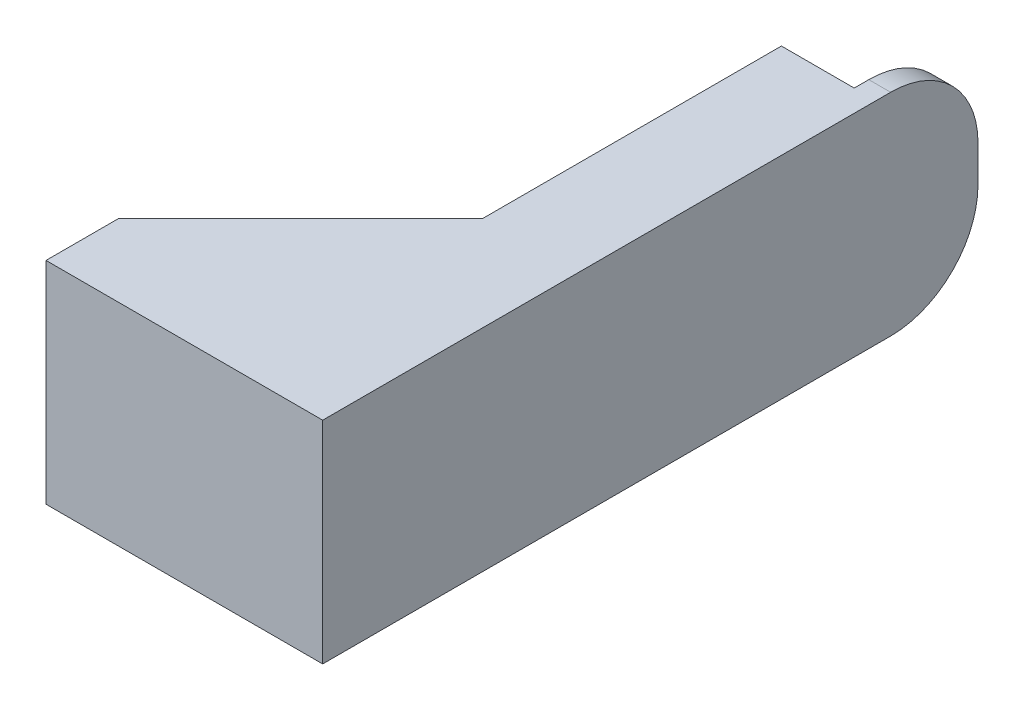
from build123d import *

# Parameters (mm, degrees)
SKETCH1_W           = 38
SKETCH1_H           = 29
BOSS_EXTRUDE1_DEPTH = 50
SKETCH2_W           = 13
SKETCH2_H           = 29
BOSS_EXTRUDE2_DEPTH = 40
CHAMFER1_SIZE       = 40
SKETCH3_W           = 10
SKETCH3_H           = 29
CUT_EXTRUDE1_DEPTH  = 14
FILLET1_R           = 12


with BuildPart() as part:
    # Sketch1 → Boss-Extrude1 (new body)
    with BuildSketch(Plane.XY):
        with Locations((-19, 0)):
            Rectangle(SKETCH1_W, SKETCH1_H)
    extrude(amount=-BOSS_EXTRUDE1_DEPTH)

    # Sketch2 → Boss-Extrude2 (add)
    with BuildSketch(Plane(origin=(0, 0, -50), x_dir=(-1, 0, 0), z_dir=(0, 0, -1))):
        with Locations((6.5, 0)):
            Rectangle(SKETCH2_W, SKETCH2_H)
    extrude(amount=BOSS_EXTRUDE2_DEPTH)

    # Chamfer1
    # the kernel refuses this chamfer: 40 mm, written as the material it takes off along each edge
    with BuildSketch(Plane(origin=(-38, -117.367319519, -50), x_dir=(-0.027495876610586317, 0, 0.9996219169112968), z_dir=(0, 1, 0))) as chamfer1_piece_1_section:
        Polygon((CHAMFER1_SIZE * 0.999621916911, CHAMFER1_SIZE * 0.0274958766106), (-CHAMFER1_SIZE * 0.0274958766106, CHAMFER1_SIZE * 0.999621916911), (0, 0), align=None)
    chamfer1_piece_1 = extrude(amount=234.734639037, mode=Mode.PRIVATE)
    chamfer1_piece_1 = split(chamfer1_piece_1, bisect_by=Plane(origin=(-13, 0, -35.169417803), z_dir=(-1, 0, 0)), keep=Keep.TOP, mode=Mode.PRIVATE)
    add(chamfer1_piece_1, mode=Mode.SUBTRACT)

    # Sketch3 → Cut-Extrude1 (cut)
    with BuildSketch(Plane(origin=(0, 0, -90), x_dir=(-1, 0, 0), z_dir=(0, 0, -1))):
        with Locations((8, 0)):
            Rectangle(SKETCH3_W, SKETCH3_H)
    extrude(amount=-CUT_EXTRUDE1_DEPTH, mode=Mode.SUBTRACT)

    # Fillet1
    fillet1_edges = [part.edges().sort_by_distance(p)[0] for p in [
        (-1.5, -14.5, -90),
        (-1.5, 14.5, -90),
    ]]
    fillet(fillet1_edges, radius=FILLET1_R)


solid = part.part
